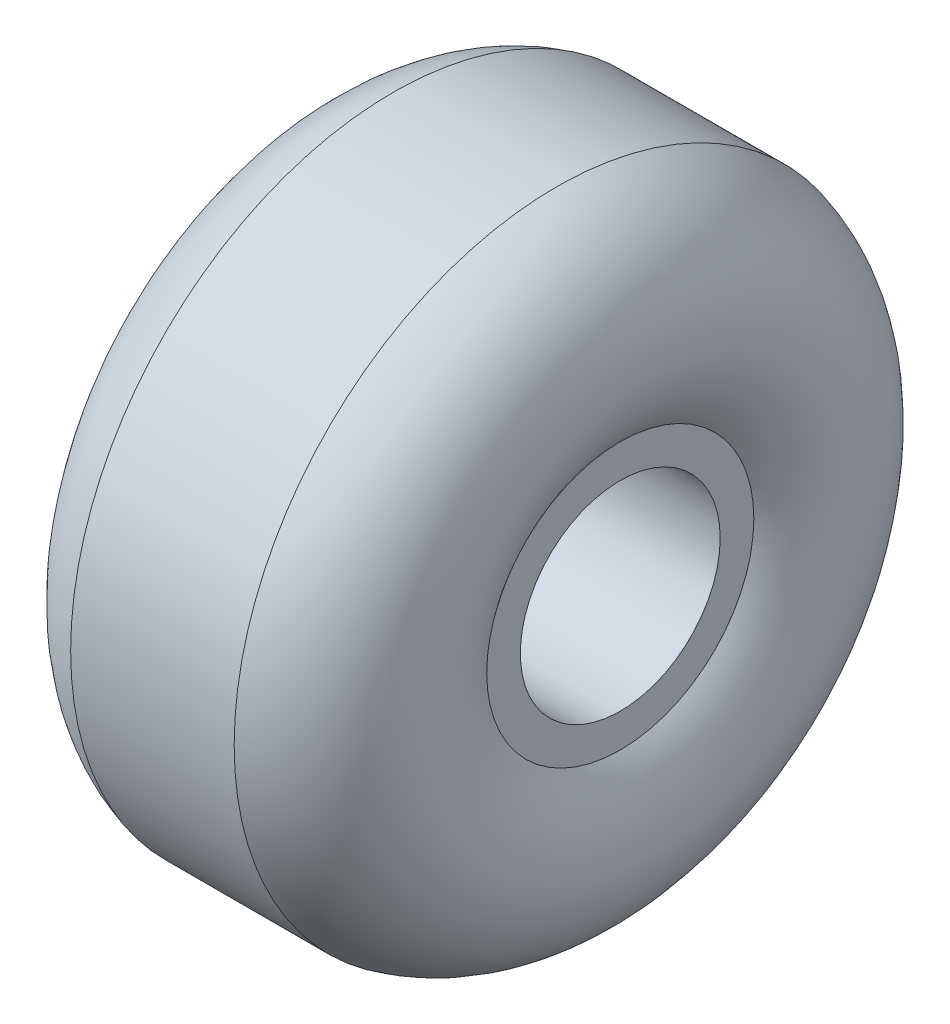
from build123d import *

# Parameters (mm, degrees)
SKETCH2_R          = 11
CUT_EXTRUDE1_DEPTH = 62.13961095


with BuildPart() as part:
    # Sketch1 → Revolve5 (revolve)
    with BuildSketch(Plane.XY):
        with BuildLine():
            Line((-16, 0), (16, 0))
            Line((16, 0), (16, 14.7))
            ThreePointArc((16, 14.7), (18.214422629, 27.023123), (9, 35.5))
            Line((9, 35.5), (-9, 35.5))
            ThreePointArc((-9, 35.5), (-18.214422629, 27.023123), (-16, 14.7))
            Line((-16, 14.7), (-16, 0))
        make_face()
    revolve(axis=Axis((-16, 0, 0), (1, 0, 0)))

    # Sketch2 → Cut-Extrude1 (cut, through all)
    with BuildSketch(Plane(origin=(16, 0, 0), x_dir=(0, 0, -1), z_dir=(1, 0, 0))):
        Circle(SKETCH2_R)
    extrude(amount=-CUT_EXTRUDE1_DEPTH, mode=Mode.SUBTRACT)


solid = part.part
